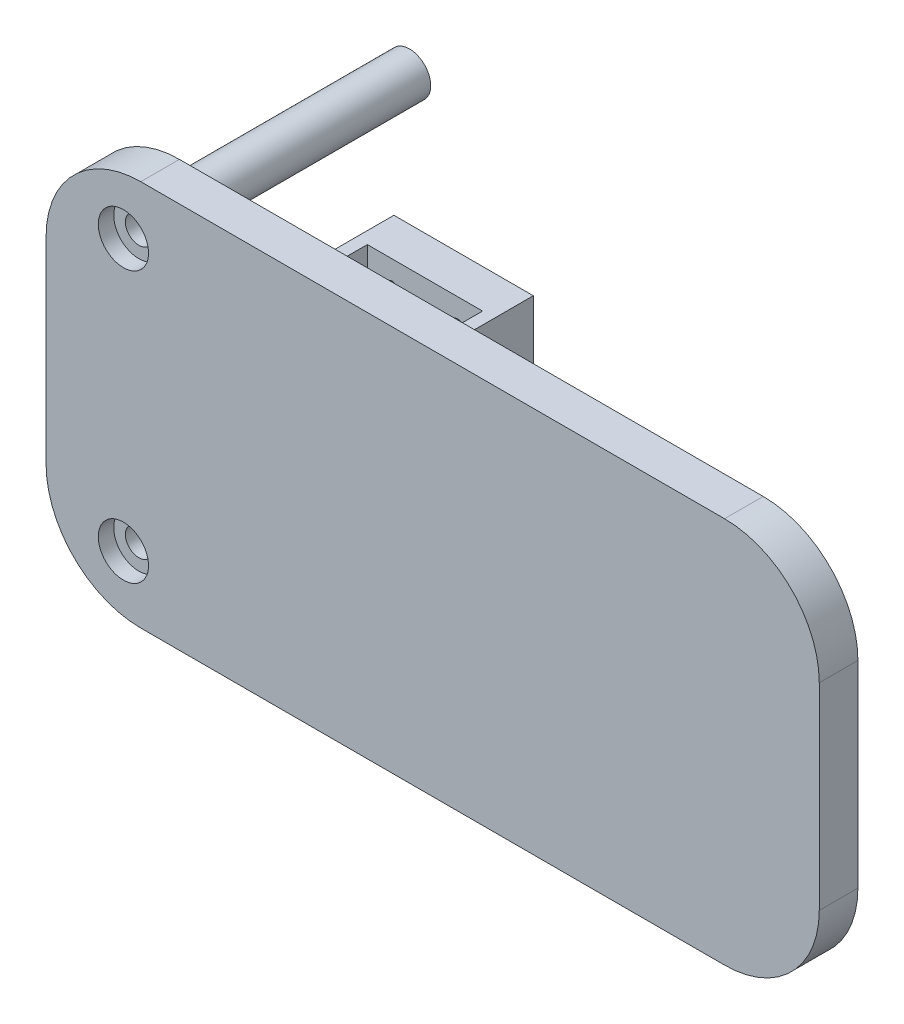
from build123d import *

# Parameters (mm, degrees)
SKETCH1_W              = 180
SKETCH1_H              = 100
BOSS_EXTRUDE1_DEPTH    = 10
FILLET1_R              = 24.5
SKETCH5_R              = 5.5
SKETCH5_R_2            = 3.5
BOSS_EXTRUDE4_DEPTH    = 64
MOVE_FACE2_DEPTH       = 10
MOVE_START             = -64
MOVE_FACE3_OUTLINE_R   = 3.5
MOVE_FACE3_DEPTH       = 64
MOVE_FACE3_2_DEPTH     = 10
MOVE_FACE3_3_OUTLINE_R = 3.5
MOVE_FACE3_3_DEPTH     = 64
SKETCH7_R              = 3.5
CUT_EXTRUDE2_DEPTH     = 74
SKETCH8_R              = 6.5
CUT_EXTRUDE3_DEPTH     = 4
SKETCH9_W              = 36.05660051
SKETCH9_H              = 87.936885764
SKETCH9_R              = 1.5
SKETCH9_W_2            = 29.8
SKETCH9_H_2            = 65
BOSS_EXTRUDE6_DEPTH    = 10
SKETCH10_W             = 3.128300255
SKETCH10_H             = 87.936885764
BOSS_EXTRUDE7_DEPTH    = 20


# Read off the part's stored shape, not the designer's step: Move Face2, Move Face3
with BuildPart() as part:
    # Sketch1 → Boss-Extrude1 (new body)
    with BuildSketch(Plane.XY):
        Rectangle(SKETCH1_W, SKETCH1_H)
    extrude(amount=BOSS_EXTRUDE1_DEPTH)

    # Fillet1
    fillet1_edges = [part.edges().sort_by_distance(p)[0] for p in [
        (90, -50, 5),
        (-90, -50, 5),
        (-90, 50, 5),
        (90, 50, 5),
    ]]
    fillet(fillet1_edges, radius=FILLET1_R)

    # Sketch5 → Boss-Extrude4 (add)
    # profile 1 of 2: a face of its own
    with BuildSketch(Plane(origin=(0, 0, 0), x_dir=(-1, 0, 0), z_dir=(0, 0, -1))):
        with Locations((80, 35)):
            Circle(SKETCH5_R)
        with Locations((80, 35)):
            Circle(SKETCH5_R_2, mode=Mode.SUBTRACT)
    # profile 2 of 2: a face of its own
    with BuildSketch(Plane(origin=(0, 0, 0), x_dir=(-1, 0, 0), z_dir=(0, 0, -1))):
        with Locations((80, -35)):
            Circle(SKETCH5_R)
        with Locations((80, -35)):
            Circle(SKETCH5_R_2, mode=Mode.SUBTRACT)
    extrude(amount=BOSS_EXTRUDE4_DEPTH)

    # Move Face2 outline → Move Face2 (add)
    with BuildSketch(Plane.XY):
        with BuildLine():
            Line((-100, 25.5), (-100, -25.5))
            ThreePointArc((-100, -25.5), (-92.824116139, -42.824116139), (-75.5, -50))
            Line((-75.5, -50), (-65.5, -50))
            ThreePointArc((-65.5, -50), (-82.824116139, -42.824116139), (-90, -25.5))
            Line((-90, -25.5), (-90, 25.5))
            ThreePointArc((-90, 25.5), (-82.824116139, 42.824116139), (-65.5, 50))
            Line((-65.5, 50), (-75.5, 50))
            ThreePointArc((-75.5, 50), (-92.824116139, 42.824116139), (-100, 25.5))
        make_face()
    extrude(amount=MOVE_FACE2_DEPTH)

    # Move Face3 outline → Move Face3 (cut)
    # profile 1 of 2: a face of its own
    with BuildSketch(Plane.XY.offset(MOVE_START)):
        with BuildLine():
            ThreePointArc((-85, 37.291287847), (-84.5, 35), (-85, 32.708712153))
            ThreePointArc((-85, 32.708712153), (-74.5, 35), (-85, 37.291287847))
        make_face()
        with Locations((-80, 35)):
            Circle(MOVE_FACE3_OUTLINE_R, mode=Mode.SUBTRACT)
    # profile 2 of 2: a face of its own
    with BuildSketch(Plane.XY.offset(MOVE_START)):
        with BuildLine():
            ThreePointArc((-85, -32.708712153), (-84.5, -35), (-85, -37.291287847))
            ThreePointArc((-85, -37.291287847), (-74.5, -35), (-85, -32.708712153))
        make_face()
        with Locations((-80, -35)):
            Circle(MOVE_FACE3_OUTLINE_R, mode=Mode.SUBTRACT)
    extrude(amount=MOVE_FACE3_DEPTH, mode=Mode.SUBTRACT)

    # Move Face3 2 outline → Move Face3 2 (add)
    with BuildSketch(Plane.XY):
        with BuildLine():
            Line((-110, 25.5), (-110, -25.5))
            ThreePointArc((-110, -25.5), (-102.824116139, -42.824116139), (-85.5, -50))
            Line((-85.5, -50), (-75.5, -50))
            ThreePointArc((-75.5, -50), (-92.824116139, -42.824116139), (-100, -25.5))
            Line((-100, -25.5), (-100, 25.5))
            ThreePointArc((-100, 25.5), (-92.824116139, 42.824116139), (-75.5, 50))
            Line((-75.5, 50), (-85.5, 50))
            ThreePointArc((-85.5, 50), (-102.824116139, 42.824116139), (-110, 25.5))
        make_face()
    extrude(amount=MOVE_FACE3_2_DEPTH)

    # Move Face3 3 outline → Move Face3 3 (add)
    # profile 1 of 2: a face of its own
    with BuildSketch(Plane.XY.offset(MOVE_START)):
        with BuildLine():
            ThreePointArc((-85, 32.708712153), (-85.5, 35), (-85, 37.291287847))
            ThreePointArc((-85, 37.291287847), (-95.5, 35), (-85, 32.708712153))
        make_face()
        with Locations((-90, 35)):
            Circle(MOVE_FACE3_3_OUTLINE_R, mode=Mode.SUBTRACT)
    # profile 2 of 2: a face of its own
    with BuildSketch(Plane.XY.offset(MOVE_START)):
        with BuildLine():
            ThreePointArc((-85, -37.291287847), (-85.5, -35), (-85, -32.708712153))
            ThreePointArc((-85, -32.708712153), (-95.5, -35), (-85, -37.291287847))
        make_face()
        with Locations((-90, -35)):
            Circle(MOVE_FACE3_3_OUTLINE_R, mode=Mode.SUBTRACT)
    extrude(amount=MOVE_FACE3_3_DEPTH)

    # Sketch7 → Cut-Extrude2 (cut)
    with BuildSketch(Plane(origin=(0, 0, -64), x_dir=(-1, 0, 0), z_dir=(0, 0, -1))):
        with Locations((90, -35)):
            Circle(SKETCH7_R)
        with Locations((90, 35)):
            Circle(SKETCH7_R)
    extrude(amount=-CUT_EXTRUDE2_DEPTH, mode=Mode.SUBTRACT)

    # Sketch8 → Cut-Extrude3 (cut)
    with BuildSketch(Plane.XY.offset(10)):
        with Locations((-90, 35)):
            Circle(SKETCH8_R)
        with Locations((-90, -35)):
            Circle(SKETCH8_R)
    extrude(amount=-CUT_EXTRUDE3_DEPTH, mode=Mode.SUBTRACT)



with BuildPart() as body_2:
    # Sketch9 → Boss-Extrude6 (new body)
    with BuildSketch(Plane(origin=(0, 0, -30), x_dir=(-1, 0, 0), z_dir=(0, 0, -1))):
        with Locations((42, -8.75)):
            Rectangle(SKETCH9_W, SKETCH9_H)
        with Locations((33.5, 28.75)):
            Circle(SKETCH9_R, mode=Mode.SUBTRACT)
        with Locations((50.5, 28.75)):
            Circle(SKETCH9_R, mode=Mode.SUBTRACT)
        with Locations((50.5, -46.25)):
            Circle(SKETCH9_R, mode=Mode.SUBTRACT)
        with Locations((33.5, -46.25)):
            Circle(SKETCH9_R, mode=Mode.SUBTRACT)
        with Locations((42, -8.75)):
            Rectangle(SKETCH9_W_2, SKETCH9_H_2, mode=Mode.SUBTRACT)
    extrude(amount=-BOSS_EXTRUDE6_DEPTH)


with BuildPart() as part_1:
    add(part.part)

    add(body_2.part)  # Boss-Extrude7 merges body 2
    # Sketch10 → Boss-Extrude7 (add)
    with BuildSketch(Plane.XY.offset(-20)):
        with Locations((-25.535849873, -8.75)):
            Rectangle(SKETCH10_W, SKETCH10_H)
        with Locations((-58.464150128, -8.75)):
            Rectangle(SKETCH10_W, SKETCH10_H)
    extrude(amount=BOSS_EXTRUDE7_DEPTH)


solid = part_1.part
